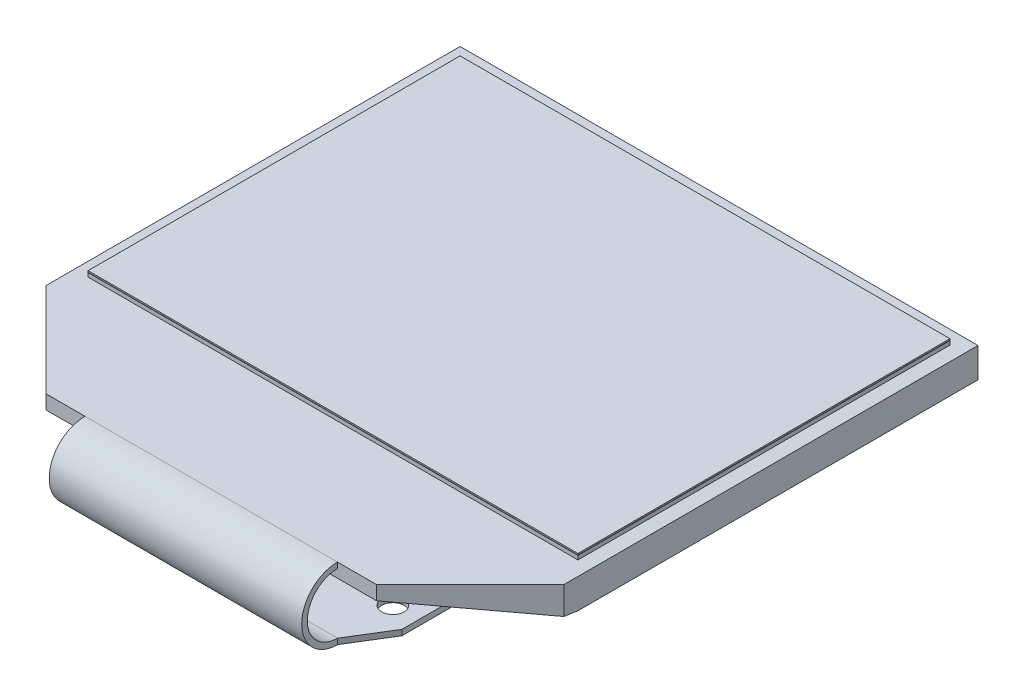
from build123d import *

# Parameters (mm, degrees)
EXTRUDE_1_DEPTH      = 0.5
SKETCH_3_W           = 9.23
SKETCH_3_H           = 14.26
EXTRUDE_2_DEPTH      = 0.56
SKETCH_4_W           = 8.73
SKETCH_4_H           = 13.26
EXTRUDE_3_DEPTH      = 0.14
SKETCH_6_W           = 6.71
SKETCH_6_H           = 10.06
CUT_EXTRUDE_1_DEPTH  = 0.02
EXTRUDE_4_REACH      = 22.328
CUT_EXTRUDE_2_DEPTH  = 21.327946281
SKETCH_9_W           = 8.73
SKETCH_9_H           = 13.26
EXTRUDE_2204_DEPTH   = 0.05
MIRROR_START         = 0.5
MIRROR_1_OUTLINE_W   = 8.73
MIRROR_1_OUTLINE_H   = 0.05
MIRROR_1_DEPTH       = 13.26
MIRROR_1_2_OUTLINE_W = 8.73
MIRROR_1_2_OUTLINE_H = 0.14
MIRROR_1_2_DEPTH     = 13.26
MIRROR_1_3_DEPTH     = 0.48
MIRROR_START_2       = -0.56
MIRROR_1_4_OUTLINE_W = 6.71
MIRROR_1_4_OUTLINE_H = 10.06
MIRROR_1_4_DEPTH     = 0.60719
MIRROR_START_3       = 0.48
MIRROR_1_5_DEPTH     = 0.02
MIRROR_START_4       = -9.23
MIRROR_1_6_DEPTH     = 9.23
MIRROR_START_5       = -20
MIRROR_1_7_OUTLINE_W = 8
MIRROR_1_7_OUTLINE_H = 2
MIRROR_1_7_DEPTH     = 3.036508319
EXTRUDE_6_DEPTH      = 4.5
EXTRUDE_7_DEPTH      = 0.2
SKETCH_15_R          = 0.4
CUT_EXTRUDE_3_DEPTH  = 22.613355246


with BuildPart() as part:
    # 草图2 → 凸台-拉伸1 (new body)
    with BuildSketch(Plane(origin=(0, 0, 0), x_dir=(1, 0, 0), z_dir=(0, 1, 0))):
        Polygon((9.23, -14.76), (5.89, -18.1), (0, -18.1), (0, 0), (9.23, 0), align=None)
    extrude(amount=EXTRUDE_1_DEPTH)

    # 草图3 → 凸台-拉伸2 (add)
    with BuildSketch(Plane.XZ):
        with Locations((4.615, 7.13)):
            Rectangle(SKETCH_3_W, SKETCH_3_H)
    extrude(amount=EXTRUDE_2_DEPTH)

    # 草图6 → 切除-拉伸1 (cut)
    with BuildSketch(Plane(origin=(0, 0.5, 0), x_dir=(1, 0, 0), z_dir=(0, 1, 0))):
        with Locations((3.355, -7.13)):
            Rectangle(SKETCH_6_W, SKETCH_6_H)
    extrude(amount=-CUT_EXTRUDE_1_DEPTH, mode=Mode.SUBTRACT)

    # 凸台-拉伸4: up to this face of the body (flat: up to its plane)
    extrude_4_end = Plane(part.part.faces().sort_by_distance((9.23, -0.025444369, 7.250073411))[0])
    # 草图8 → 凸台-拉伸4 (add, up to the picked face)
    with BuildSketch(Plane.ZY, mode=Mode.PRIVATE) as extrude_4_sk1:
        Polygon((14.26, 0), (18.1, 0), (14.26, -0.56), align=None)
    extrude_4_tool1 = split(extrude(extrude_4_sk1.sketch, amount=-EXTRUDE_4_REACH, mode=Mode.PRIVATE), bisect_by=extrude_4_end, keep=Keep.BOTH, mode=Mode.PRIVATE)
    add(extrude_4_tool1.solids().sort_by(Axis((0, -0.186667, 15.54), (1, 0, 0)))[0])

    # 草图12 → 切除-拉伸2 (cut, through all)
    with BuildSketch(Plane(origin=(0, 0, 0), x_dir=(1, 0, 0), z_dir=(0, 1, 0))):
        Polygon((9.23, -14.76), (5.89, -18.1), (9.23, -18.1), align=None)
    extrude(amount=-CUT_EXTRUDE_2_DEPTH, mode=Mode.SUBTRACT)

    # Mirror 1 3 outline → Mirror 1 3 (add)
    with BuildSketch(Plane(origin=(0, 0, 0), x_dir=(1, 0, 0), z_dir=(0, 1, 0))):
        Polygon((-5.89, -18.1), (0, -18.1), (0, 0), (-9.23, 0), (-9.23, -14.76), align=None)
    extrude(amount=MIRROR_1_3_DEPTH)

    # Mirror 1 4 outline → Mirror 1 4 (add)
    with BuildSketch(Plane(origin=(0, 0, 0), x_dir=(1, 0, 0), z_dir=(0, 1, 0)).offset(MIRROR_START_2)):
        with Locations((-3.355, -7.13)):
            Rectangle(MIRROR_1_4_OUTLINE_W, MIRROR_1_4_OUTLINE_H)
    extrude(amount=MIRROR_1_4_DEPTH)

    # Mirror 1 5 outline → Mirror 1 5 (add)
    with BuildSketch(Plane(origin=(0, 0, 0), x_dir=(1, 0, 0), z_dir=(0, 1, 0)).offset(MIRROR_START_3)):
        Polygon((-5.89, -18.1), (0, -18.1), (0, -12.16), (-6.71, -12.16), (-6.71, -2.1), (0, -2.1), (0, 0), (-9.23, 0), (-9.23, -14.76), align=None)
    extrude(amount=MIRROR_1_5_DEPTH)

    # Mirror 1 6 outline → Mirror 1 6 (add)
    with BuildSketch(Plane.YZ.offset(MIRROR_START_4)):
        Polygon((-0.56, 0), (0, 0), (0, 18.1), (-0.56, 14.26), align=None)
    extrude(amount=MIRROR_1_6_DEPTH)

    # Mirror 1 7 outline → Mirror 1 7 (cut)
    with BuildSketch(Plane(origin=(0, 0, 0), x_dir=(0.707106781186552, 0, 0.7071067811865429), z_dir=(0.707106781186543, 0, -0.707106781186552)).offset(MIRROR_START_5)):
        with Locations((6, 1)):
            Rectangle(MIRROR_1_7_OUTLINE_W, MIRROR_1_7_OUTLINE_H)
    extrude(amount=MIRROR_1_7_DEPTH, mode=Mode.SUBTRACT)

    # 草图11 → 凸台-拉伸6 (add, symmetric)
    with BuildSketch(Plane(origin=(0, 0, 0), x_dir=(0, 0, -1), z_dir=(1, 0, 0))):
        with BuildLine():
            Line((-18.1, -2.05), (-18.1, -1.85))
            ThreePointArc((-18.1, -1.85), (-19.175, -0.775), (-18.1, 0.3))
            Line((-18.1, 0.3), (-18.1, 0.5))
            ThreePointArc((-18.1, 0.5), (-19.375, -0.775), (-18.1, -2.05))
        make_face()
    extrude(amount=EXTRUDE_6_DEPTH, both=True)

    # 草图14 → 凸台-拉伸7 (add)
    with BuildSketch(Plane(origin=(0, -2.05, 0), x_dir=(-1, 0, 0), z_dir=(0, -1, 0))):
        Polygon((-5.375, -16.68), (-5.375, -12), (0, -12), (0, -18.1), (-4.5, -18.1), align=None)
    extrude_7 = extrude(amount=-EXTRUDE_7_DEPTH)

    # 草图15 → 切除-拉伸3 (cut, through all)
    with BuildSketch(Plane(origin=(0, -1.85, 0), x_dir=(1, 0, 0), z_dir=(0, 1, 0))):
        with Locations(Location((4.475, -16.1, 0), (0, 0, 270))):
            Circle(SKETCH_15_R)
    cut_extrude_3 = extrude(amount=-CUT_EXTRUDE_3_DEPTH, mode=Mode.SUBTRACT)

    # 镜向2: 凸台-拉伸7, 切除-拉伸3 across Right Plane
    add(extrude_7.mirror(Plane(origin=(0, 0, 0), x_dir=(0, 0, -1), z_dir=(1, 0, 0))))
    add(cut_extrude_3.mirror(Plane(origin=(0, 0, 0), x_dir=(0, 0, -1), z_dir=(1, 0, 0))), mode=Mode.SUBTRACT)


with BuildPart() as body_2:
    # 草图4 → 凸台-拉伸3 (new body)
    with BuildSketch(Plane(origin=(0, 0.51, 0), x_dir=(1, 0, 0), z_dir=(0, 1, 0))):
        with Locations((4.365, -7.13)):
            Rectangle(SKETCH_4_W, SKETCH_4_H)
    extrude(amount=EXTRUDE_3_DEPTH)

    # Mirror 1 2 outline → Mirror 1 2 (add)
    with BuildSketch(Plane.XY.offset(MIRROR_START)):
        with Locations((-4.365, 0.58)):
            Rectangle(MIRROR_1_2_OUTLINE_W, MIRROR_1_2_OUTLINE_H)
    extrude(amount=MIRROR_1_2_DEPTH)


with BuildPart() as body_3:
    # 草图9 → Extrude 2204 (new body)
    with BuildSketch(Plane(origin=(0, 0.66, 0), x_dir=(1, 0, 0), z_dir=(0, 1, 0))):
        with Locations((4.365, -7.13)):
            Rectangle(SKETCH_9_W, SKETCH_9_H)
    extrude(amount=EXTRUDE_2204_DEPTH)

    # 镜向1: read off the stored shape, not the designer's step
    # 镜向1 outline → 镜向1 (add)
    with BuildSketch(Plane.XY.offset(MIRROR_START)):
        with Locations((-4.365, 0.685)):
            Rectangle(MIRROR_1_OUTLINE_W, MIRROR_1_OUTLINE_H)
    extrude(amount=MIRROR_1_DEPTH)


solid = Compound([part.part, body_2.part, body_3.part])
